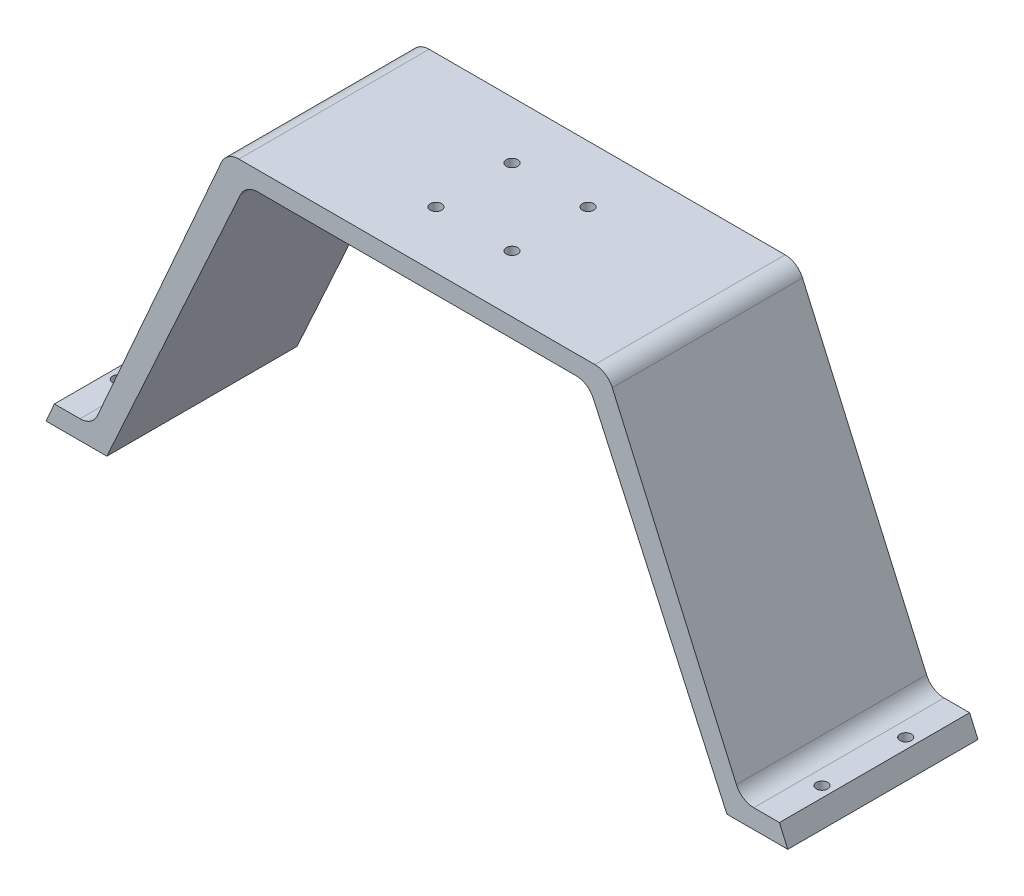
from build123d import *

# Parameters (mm, degrees)
BOSS_EXTRUDE2_DEPTH = 50
CUT_EXTRUDE1_DEPTH  = 50
FILLET1_R           = 5
SKETCH10_W          = 50
SKETCH10_H          = 5.46
BOSS_EXTRUDE4_DEPTH = 10
SKETCH5_W           = 50
SKETCH5_H           = 5.464
BOSS_EXTRUDE5_DEPTH = 10
SKETCH11_R          = 1.5
CUT_EXTRUDE2_DEPTH  = 10
SKETCH12_R          = 1.5
CUT_EXTRUDE3_DEPTH  = 10
FILLET2_R           = 5
FILLET3_R           = 5
SKETCH13_R          = 1.5
CUT_EXTRUDE5_DEPTH  = 10
SKETCH14_R          = 3
CUT_EXTRUDE6_DEPTH  = 2.5


with BuildPart() as part:
    # Sketch1 → Boss-Extrude2 (new body)
    with BuildSketch(Plane.XY):
        Polygon((-87.5, 0), (87.5, 0), (50.05, 85), (-50.05, 85), align=None)
    extrude(amount=BOSS_EXTRUDE2_DEPTH)

    # Sketch3 → Cut-Extrude1 (cut)
    with BuildSketch(Plane.XY.offset(50)):
        Polygon((-81.5, 0), (81.5, 0), (45.05, 80), (-45.05, 80), align=None)
    extrude(amount=-CUT_EXTRUDE1_DEPTH, mode=Mode.SUBTRACT)

    # Fillet1
    fillet1_edges = [part.edges().sort_by_distance(p)[0] for p in [
        (45.05, 80, 25),
        (-45.05, 80, 25),
    ]]
    fillet(fillet1_edges, radius=FILLET1_R)

    # Sketch10 → Boss-Extrude4 (add, along a direction that is not the sketch's normal)
    with BuildSketch(Plane(origin=(-73.275840836, 32.284473404, 0), x_dir=(0, 0, 1), z_dir=(-0.9151164849241618, 0.4031895571812924, 0))):
        with Locations((25, -32.549086253)):
            Rectangle(SKETCH10_W, SKETCH10_H)
    extrude(amount=BOSS_EXTRUDE4_DEPTH, dir=(-1, 0, 0))

    # Sketch5 → Boss-Extrude5 (add, along a direction that is not the sketch's normal)
    with BuildSketch(Plane(origin=(73.275840836, 32.284473404, 0), x_dir=(0, 0, -1), z_dir=(0.9151164849241616, 0.4031895571812925, 0))):
        with Locations((-25, -32.547086253)):
            Rectangle(SKETCH5_W, SKETCH5_H)
    extrude(amount=BOSS_EXTRUDE5_DEPTH, dir=(1, 0, 0))

    # Sketch11 → Cut-Extrude2 (cut)
    with BuildSketch(Plane(origin=(0, 4.996536008, 0), x_dir=(1, 0, 0), z_dir=(0, 1, 0))):
        with Locations((-92.5, -14)):
            Circle(SKETCH11_R)
        with Locations((-92.5, -36)):
            Circle(SKETCH11_R)
    extrude(amount=-CUT_EXTRUDE2_DEPTH, mode=Mode.SUBTRACT)

    # Sketch12 → Cut-Extrude3 (cut)
    with BuildSketch(Plane(origin=(0, 5.000196474, 0), x_dir=(1, 0, 0), z_dir=(0, 1, 0))):
        with Locations((92.5, -14)):
            Circle(SKETCH12_R)
        with Locations((92.5, -36)):
            Circle(SKETCH12_R)
    extrude(amount=-CUT_EXTRUDE3_DEPTH, mode=Mode.SUBTRACT)

    # Fillet2
    fillet2_edges = [part.edges().sort_by_distance(p)[0] for p in [
        (85.29697226, 5.000196474, 25),
        (-85.298585018, 4.996536008, 25),
    ]]
    fillet(fillet2_edges, radius=FILLET2_R)

    # Fillet3
    fillet3_edges = [part.edges().sort_by_distance(p)[0] for p in [
        (50.05, 85, 25),
        (-50.05, 85, 25),
    ]]
    fillet(fillet3_edges, radius=FILLET3_R)

    # Sketch13 → Cut-Extrude5 (cut)
    with BuildSketch(Plane(origin=(0, 85, 0), x_dir=(1, 0, 0), z_dir=(0, 1, 0))):
        with Locations((-9.999155874, -15)):
            Circle(SKETCH13_R)
        with Locations((10.000844126, -15)):
            Circle(SKETCH13_R)
        with Locations((-9.999155874, -35)):
            Circle(SKETCH13_R)
        with Locations((10.000844126, -35)):
            Circle(SKETCH13_R)
    extrude(amount=-CUT_EXTRUDE5_DEPTH, mode=Mode.SUBTRACT)

    # Sketch14 → Cut-Extrude6 (cut)
    with BuildSketch(Plane.XZ.offset(-80)):
        with Locations((-9.999155874, 35)):
            Circle(SKETCH14_R)
        with Locations((-9.999155874, 15)):
            Circle(SKETCH14_R)
        with Locations((10.000844126, 35)):
            Circle(SKETCH14_R)
        with Locations((10.000844126, 15)):
            Circle(SKETCH14_R)
    extrude(amount=-CUT_EXTRUDE6_DEPTH, mode=Mode.SUBTRACT)


solid = part.part
